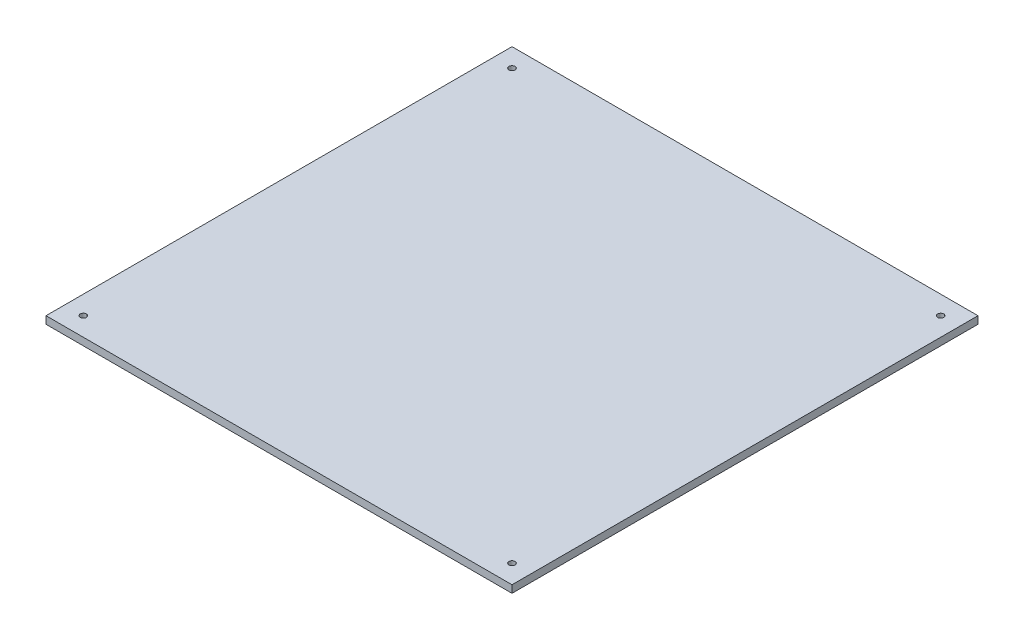
from build123d import *

# Parameters (mm, degrees)
SKETCH1_W           = 250
SKETCH1_H           = 250
SKETCH1_R           = 1.65
BOSS_EXTRUDE1_DEPTH = 4


with BuildPart() as part:
    # Sketch1 → Boss-Extrude1 (new body)
    with BuildSketch(Plane(origin=(0, 0, 0), x_dir=(1, 0, 0), z_dir=(0, 1, 0))):
        with Locations((125, 125)):
            Rectangle(SKETCH1_W, SKETCH1_H)
        with Locations((10, 10)):
            Circle(SKETCH1_R, mode=Mode.SUBTRACT)
        with Locations((240, 10)):
            Circle(SKETCH1_R, mode=Mode.SUBTRACT)
        with Locations((240, 240)):
            Circle(SKETCH1_R, mode=Mode.SUBTRACT)
        with Locations((10, 240)):
            Circle(SKETCH1_R, mode=Mode.SUBTRACT)
    extrude(amount=BOSS_EXTRUDE1_DEPTH)


solid = part.part
